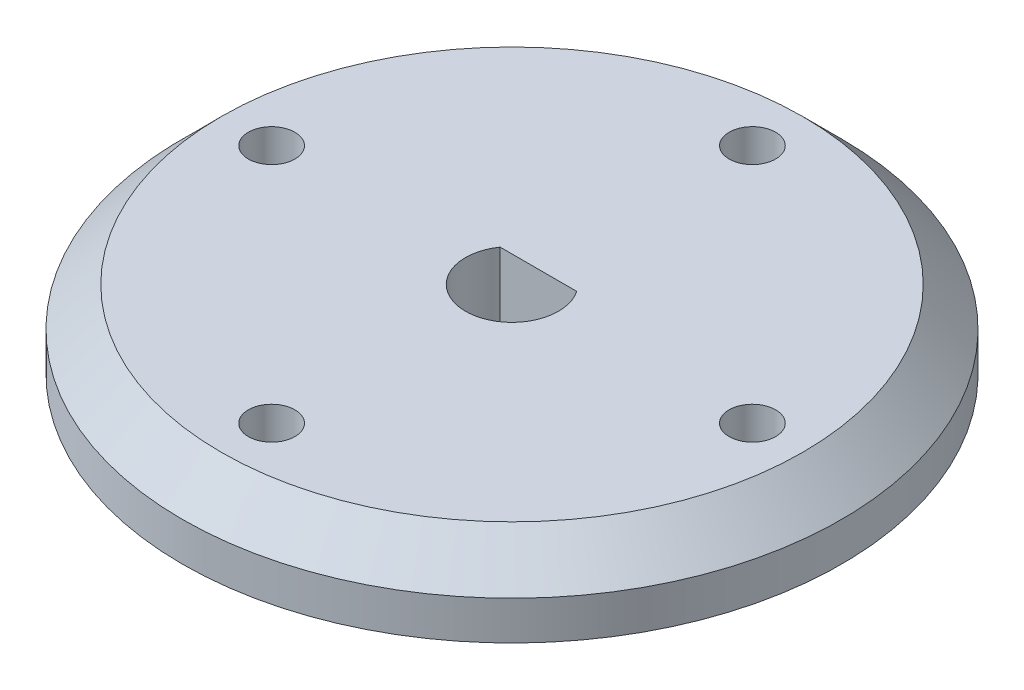
from build123d import *

# Parameters (mm, degrees)
SKETCH1_R           = 21.25
SKETCH1_R_2         = 1.5
BOSS_EXTRUDE1_DEPTH = 5
CHAMFER1_SIZE       = 2.5


with BuildPart() as part:
    # Sketch1 → Boss-Extrude1 (new body)
    with BuildSketch(Plane(origin=(0, 0, 0), x_dir=(1, 0, 0), z_dir=(0, 1, 0))):
        Circle(SKETCH1_R)
        with Locations((0, 15.5)):
            Circle(SKETCH1_R_2, mode=Mode.SUBTRACT)
        with Locations((15.5, 0)):
            Circle(SKETCH1_R_2, mode=Mode.SUBTRACT)
        with Locations((0, -15.5)):
            Circle(SKETCH1_R_2, mode=Mode.SUBTRACT)
        with Locations((-15.5, 0)):
            Circle(SKETCH1_R_2, mode=Mode.SUBTRACT)
        with BuildLine():
            Line((-2.471841419, 1.7), (2.471841419, 1.7))
            ThreePointArc((2.471841419, 1.7), (0, -3), (-2.471841419, 1.7))
        make_face(mode=Mode.SUBTRACT)
    extrude(amount=BOSS_EXTRUDE1_DEPTH)

    # Chamfer1
    chamfer1_edges = [part.edges().sort_by_distance(p)[0] for p in [
        (-21.25, 5, 0),
    ]]
    chamfer(chamfer1_edges, length=CHAMFER1_SIZE)


solid = part.part
